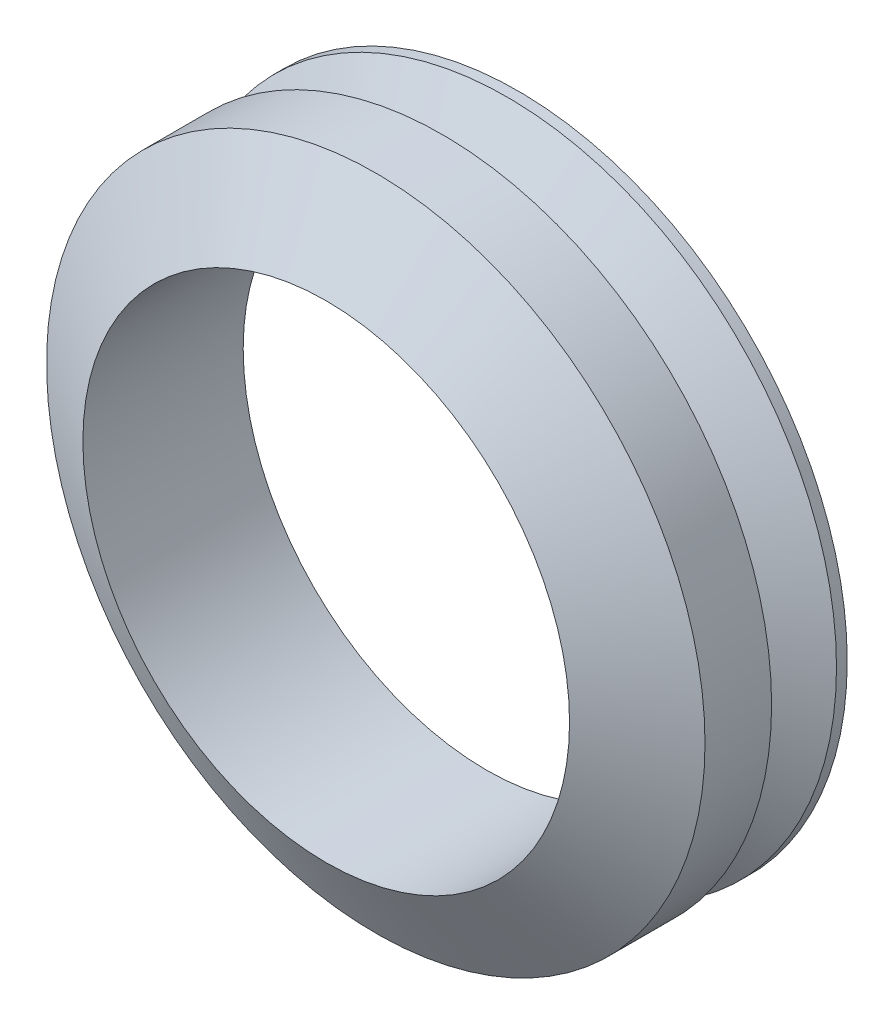
from build123d import *


with BuildPart() as part:
    # Esquisse1 → Base-Révolution (revolve)
    with BuildSketch(Plane(origin=(0, 0, 0), x_dir=(0, 0, -1), z_dir=(1, 0, 0))):
        Polygon((0, 8.5), (5.6, 8.5), (6.7, 11.5), (6.325, 11.5), (4.93173625, 9.1), (4.058207688, 11.5), (1.732050808, 11.5), align=None)
    revolve(axis=Axis((0, 0, 0), (0, 0, -1)))


solid = part.part
